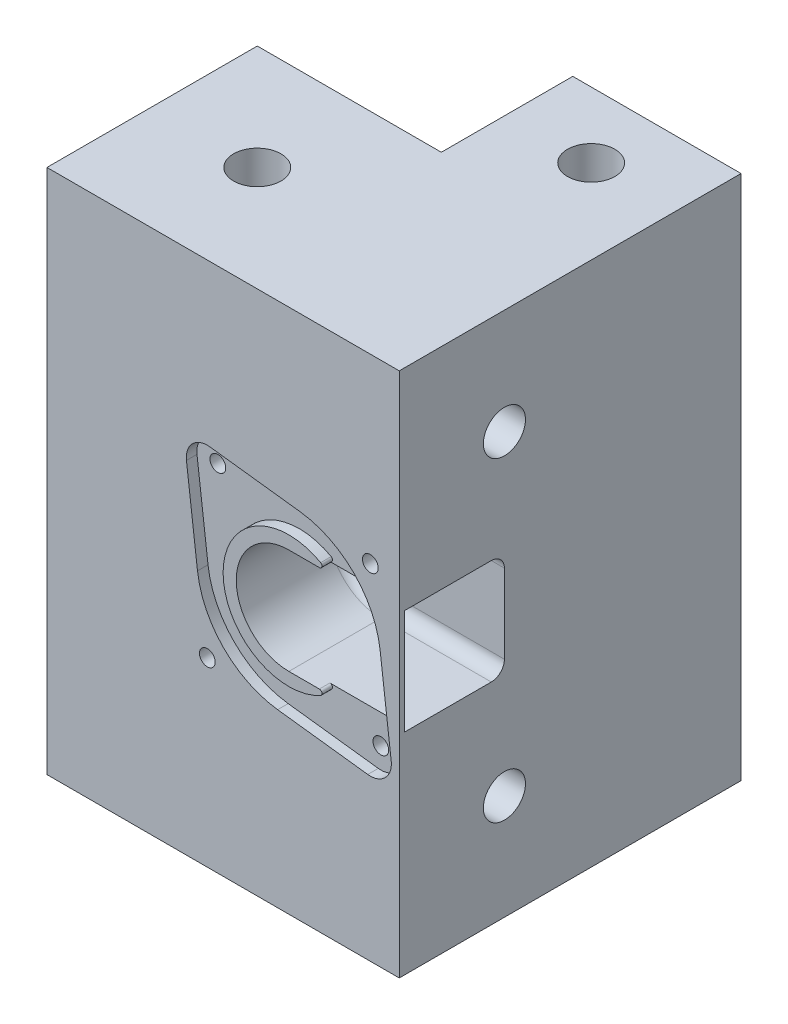
from build123d import *

# Parameters (mm, degrees)
SKETCH1_R                               = 4.5
BOSS_EXTRUDE1_DEPTH                     = 100
CBORE_FOR_M5_HEX_HEAD_BOLT2_D           = 13.5
CBORE_FOR_M5_HEX_HEAD_BOLT2_DEPTH       = 23.85
CBORE_FOR_M5_HEX_HEAD_BOLT2_CBORE_D     = 32
CBORE_FOR_M5_HEX_HEAD_BOLT2_CBORE_DEPTH = 5
CBORE_FOR_M5_HEX_HEAD_BOLT3_D           = 10.2
CBORE_FOR_M5_HEX_HEAD_BOLT3_DEPTH       = 13.5
CBORE_FOR_M5_HEX_HEAD_BOLT3_CBORE_D     = 22
CBORE_FOR_M5_HEX_HEAD_BOLT3_CBORE_DEPTH = 3.5
SKETCH8_R                               = 4
CUT_EXTRUDE1_DEPTH                      = 27
SKETCH9_R                               = 1.5
CUT_EXTRUDE2_DEPTH                      = 119
SKETCH10_R                              = 10
CUT_EXTRUDE3_DEPTH                      = 20
SKETCH11_W                              = 19
SKETCH11_H                              = 20
CUT_EXTRUDE4_DEPTH                      = 21
FILLET2_R                               = 2.5
CUT_EXTRUDE8_REACH                      = 131.298
CUT_EXTRUDE8_START                      = -5
SKETCH13_R                              = 3
CUT_EXTRUDE9_DEPTH                      = 2


with BuildPart() as part:
    # Sketch1 → Boss-Extrude1 (new body)
    with BuildSketch(Plane(origin=(0, 0, 0), x_dir=(1, 0, 0), z_dir=(0, 1, 0))):
        Polygon((-35, 0), (0, 0), (0, 25), (32, 25), (32, -40), (-35, -40), align=None)
        with Locations((-15, -20)):
            Circle(SKETCH1_R, mode=Mode.SUBTRACT)
        with Locations((16, 12.5)):
            Circle(SKETCH1_R, mode=Mode.SUBTRACT)
    extrude(amount=BOSS_EXTRUDE1_DEPTH)

    # CBORE for M5 Hex Head Bolt2
    with Locations(Plane(origin=(0, 0, 0), x_dir=(-1, 0, 0), z_dir=(0, -1, 0))):
        with Locations((15, -20)):
            CounterBoreHole(CBORE_FOR_M5_HEX_HEAD_BOLT2_D / 2, CBORE_FOR_M5_HEX_HEAD_BOLT2_CBORE_D / 2, CBORE_FOR_M5_HEX_HEAD_BOLT2_CBORE_DEPTH, depth=CBORE_FOR_M5_HEX_HEAD_BOLT2_DEPTH)

    # CBORE for M5 Hex Head Bolt3
    with Locations(Plane(origin=(0, 0, 0), x_dir=(-1, 0, 0), z_dir=(0, -1, 0))):
        with Locations((-16, 12.5)):
            CounterBoreHole(CBORE_FOR_M5_HEX_HEAD_BOLT3_D / 2, CBORE_FOR_M5_HEX_HEAD_BOLT3_CBORE_D / 2, CBORE_FOR_M5_HEX_HEAD_BOLT3_CBORE_DEPTH, depth=CBORE_FOR_M5_HEX_HEAD_BOLT3_DEPTH)

    # Sketch8 → Cut-Extrude1 (cut)
    with BuildSketch(Plane(origin=(32, 0, 0), x_dir=(0, 0, -1), z_dir=(1, 0, 0))):
        with Locations((-20, 80)):
            Circle(SKETCH8_R)
        with Locations((-20, 20)):
            Circle(SKETCH8_R)
    extrude(amount=-CUT_EXTRUDE1_DEPTH, mode=Mode.SUBTRACT)

    # Sketch9 → Cut-Extrude2 (cut)
    with BuildSketch(Plane.XY.offset(40)):
        with Locations((-4.5, 65.5)):
            Circle(SKETCH9_R)
        with Locations((26.5, 65.5)):
            Circle(SKETCH9_R)
        with Locations((26.5, 34.5)):
            Circle(SKETCH9_R)
        with Locations((-4.5, 34.5)):
            Circle(SKETCH9_R)
    extrude(amount=-CUT_EXTRUDE2_DEPTH, mode=Mode.SUBTRACT)

    # Sketch10 → Cut-Extrude3 (cut)
    with BuildSketch(Plane.XY.offset(40)):
        with Locations((11, 50)):
            Circle(SKETCH10_R)
    extrude(amount=-CUT_EXTRUDE3_DEPTH, mode=Mode.SUBTRACT)

    # Sketch11 → Cut-Extrude4 (cut)
    with BuildSketch(Plane(origin=(32, 0, 0), x_dir=(0, 0, -1), z_dir=(1, 0, 0))):
        with Locations((-29.5, 50)):
            Rectangle(SKETCH11_W, SKETCH11_H)
    extrude(amount=-CUT_EXTRUDE4_DEPTH, mode=Mode.SUBTRACT)

    # Fillet2
    fillet2_edges = [part.edges().sort_by_distance(p)[0] for p in [
        (21.5, 40, 20),
        (1, 50, 20),
        (21.5, 60, 20),
    ]]
    fillet(fillet2_edges, radius=FILLET2_R)

    # Sketch13 → Cut-Extrude8 (cut, up to next)
    with BuildSketch(Plane.XY.offset(40).offset(CUT_EXTRUDE8_START), mode=Mode.PRIVATE) as cut_extrude8_sk1:
        with Locations((-4.5, 65.5)):
            Circle(SKETCH13_R)
    cut_extrude8_tool1 = extrude(cut_extrude8_sk1.sketch, amount=-CUT_EXTRUDE8_REACH, mode=Mode.PRIVATE) & part.part
    # Sketch13 → Cut-Extrude8 (cut, up to next)
    with BuildSketch(Plane.XY.offset(40).offset(CUT_EXTRUDE8_START), mode=Mode.PRIVATE) as cut_extrude8_sk2:
        with Locations((26.5, 65.5)):
            Circle(SKETCH13_R)
    cut_extrude8_tool2 = extrude(cut_extrude8_sk2.sketch, amount=-CUT_EXTRUDE8_REACH, mode=Mode.PRIVATE) & part.part
    # Sketch13 → Cut-Extrude8 (cut, up to next)
    with BuildSketch(Plane.XY.offset(40).offset(CUT_EXTRUDE8_START), mode=Mode.PRIVATE) as cut_extrude8_sk3:
        with Locations((26.5, 34.5)):
            Circle(SKETCH13_R)
    cut_extrude8_tool3 = extrude(cut_extrude8_sk3.sketch, amount=-CUT_EXTRUDE8_REACH, mode=Mode.PRIVATE) & part.part
    # Sketch13 → Cut-Extrude8 (cut, up to next)
    with BuildSketch(Plane.XY.offset(40).offset(CUT_EXTRUDE8_START), mode=Mode.PRIVATE) as cut_extrude8_sk4:
        with Locations((-4.5, 34.5)):
            Circle(SKETCH13_R)
    cut_extrude8_tool4 = extrude(cut_extrude8_sk4.sketch, amount=-CUT_EXTRUDE8_REACH, mode=Mode.PRIVATE) & part.part
    add(cut_extrude8_tool1.solids().sort_by_distance((-4.5, 65.5, 35))[0], mode=Mode.SUBTRACT)
    add(cut_extrude8_tool2.solids().sort_by_distance((26.5, 65.5, 35))[0], mode=Mode.SUBTRACT)
    add(cut_extrude8_tool3.solids().sort_by_distance((26.5, 34.5, 35))[0], mode=Mode.SUBTRACT)
    add(cut_extrude8_tool4.solids().sort_by_distance((-4.5, 34.5, 35))[0], mode=Mode.SUBTRACT)

    # Sketch15 → Cut-Extrude9 (cut)
    with BuildSketch(Plane.XY.offset(40)):
        with BuildLine():
            Line((30.470311747, 34.986440779), (28.370113893, 52.128178409))
            ThreePointArc((28.370113893, 52.128178409), (23.374452417, 62.374284924), (13.128413522, 67.370085085))
            Line((13.128413522, 67.370085085), (-4.013773875, 69.470573556))
            ThreePointArc((-4.013773875, 69.470573556), (-7.328695519, 68.328695519), (-8.470573556, 65.013773874))
            Line((-8.470573556, 65.013773874), (-6.370113893, 47.871821591))
            ThreePointArc((-6.370113893, 47.871821591), (-1.374368671, 37.625631329), (8.871821591, 32.629886107))
            Line((8.871821591, 32.629886107), (26.013559221, 30.529688253))
            ThreePointArc((26.013559221, 30.529688253), (29.328427125, 31.671572875), (30.470311747, 34.986440779))
        make_face()
        with BuildLine():
            Line((11, 60), (16.809475019, 60))
            ThreePointArc((16.809475019, 60), (17.293597938, 60.375), (17.051536478, 60.9375))
            ThreePointArc((17.051536478, 60.9375), (-1.5, 50), (17.051536478, 39.0625))
            ThreePointArc((17.051536478, 39.0625), (17.293597938, 39.625), (16.809475019, 40))
            Line((16.809475019, 40), (11, 40))
            ThreePointArc((11, 40), (21, 50), (11, 60))
        make_face(mode=Mode.SUBTRACT)
    extrude(amount=-CUT_EXTRUDE9_DEPTH, mode=Mode.SUBTRACT)


solid = part.part
